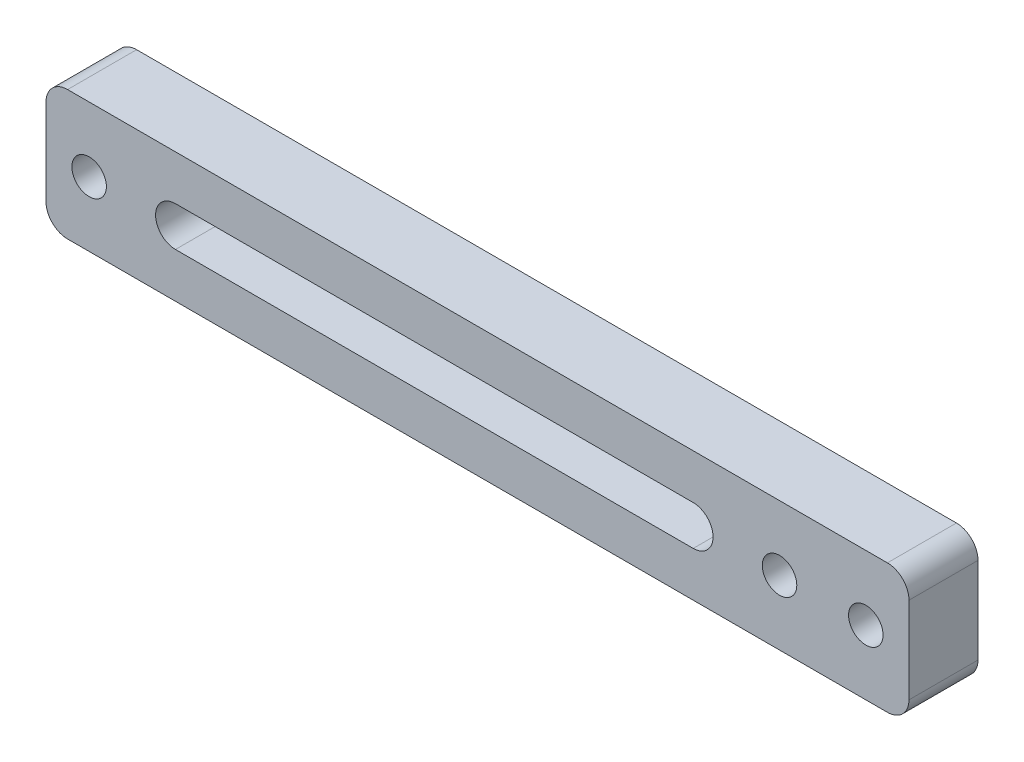
from build123d import *

# Parameters (mm, degrees)
SKETCH_1_W          = 100
SKETCH_1_H          = 15
EXTRUDE_1_DEPTH     = 8
SKETCH_2_R          = 2
CUT_EXTRUDE_2_DEPTH = 8
FILLET_2_R          = 2.5


with BuildPart() as part:
    # Эскиз1 → Вытянуть1 (new body)
    with BuildSketch(Plane.XY):
        with Locations((50, 7.5)):
            Rectangle(SKETCH_1_W, SKETCH_1_H)
    extrude(amount=EXTRUDE_1_DEPTH)

    # Эскиз2 → Вытянуть2 (cut)
    with BuildSketch(Plane.XY.offset(8)):
        with Locations((5, 7.5)):
            Circle(SKETCH_2_R)
        with Locations((95, 7.5)):
            Circle(SKETCH_2_R)
        with Locations((85, 7.5)):
            Circle(SKETCH_2_R)
        with BuildLine():
            Line((15, 9.8), (75, 9.8))
            ThreePointArc((75, 9.8), (77.3, 7.5), (75, 5.2))
            Line((75, 5.2), (15, 5.2))
            ThreePointArc((15, 5.2), (12.7, 7.5), (15, 9.8))
        make_face()
    extrude(amount=-CUT_EXTRUDE_2_DEPTH, mode=Mode.SUBTRACT)

    # Скругление2
    fillet_2_edges = [part.edges().sort_by_distance(p)[0] for p in [
        (0, 0, 4),
        (0, 15, 4),
        (100, 0, 4),
        (100, 15, 4),
    ]]
    fillet(fillet_2_edges, radius=FILLET_2_R)


solid = part.part
